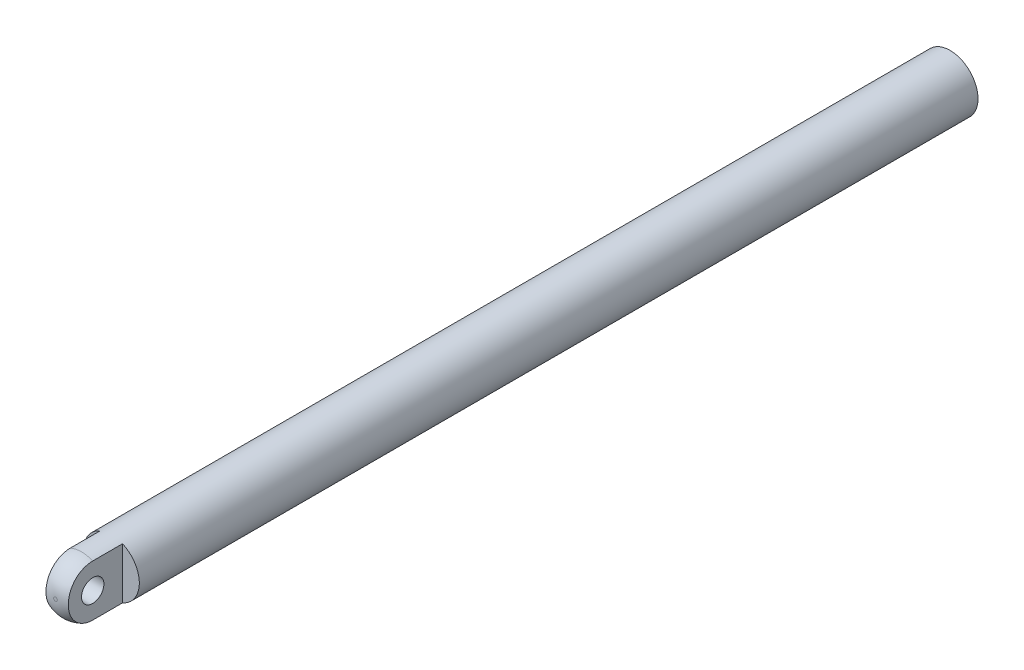
from build123d import *

# Parameters (mm, degrees)
SKETCH_1_R          = 75
EXTRUDE_1_DEPTH     = 2400
CUT_EXTRUDE_1_DEPTH = 150
SKETCH_3_R          = 30
CUT_EXTRUDE_2_DEPTH = 150
FILLET_1_R          = 70
SKETCH_4_R          = 60
CUT_EXTRUDE_4_DEPTH = 2200
SCALE_1_SCALE       = 0.345


with BuildPart() as part:
    # 草图1 → 凸台-拉伸1 (new body)
    with BuildSketch(Plane.XY):
        Circle(SKETCH_1_R)
    extrude(amount=EXTRUDE_1_DEPTH)

    # 草图2 → 切除-拉伸1 (cut)
    with BuildSketch(Plane.XY.offset(2400)):
        Polygon((-30, 75), (-30, -75), (-133.073279379, -42.369308492), (-77.396642949, 65.414797111), align=None)
        Polygon((30, 75), (30, -75), (106.458623503, -47.875789018), (106.458623503, 55.829594222), align=None)
    extrude(amount=-CUT_EXTRUDE_1_DEPTH, mode=Mode.SUBTRACT)

    # 草图3 → 切除-拉伸2 (cut)
    with BuildSketch(Plane(origin=(30, 0, 0), x_dir=(0, 0, -1), z_dir=(1, 0, 0))):
        with Locations((-2330, 0)):
            Circle(SKETCH_3_R)
    extrude(amount=-CUT_EXTRUDE_2_DEPTH, mode=Mode.SUBTRACT)

    # 圆角1
    # the kernel refuses this fillet: 70 mm, written as the material it takes off along each edge
    with BuildSketch(Plane(origin=(0, 0, 2400), x_dir=(0.3861785994276561, -0.922424029036589, 0), z_dir=(-0.922424029036589, -0.3861785994276561, 0))) as fillet_1_piece_1:
        with BuildLine():
            CenterArc((75 - FILLET_1_R, -FILLET_1_R), FILLET_1_R, 0, 90)
            Line((75 - FILLET_1_R, 0), (75, 0))
            Line((75, 0), (75, -FILLET_1_R))
        make_face()
    revolve(axis=Axis((0, 0, 2400), (0, 0, 1)), revolution_arc=314.566142673, mode=Mode.SUBTRACT)
    with BuildSketch(Plane(origin=(0, 0, 2400), x_dir=(-0.386178599427656, 0.922424029036589, 0), z_dir=(0.922424029036589, 0.386178599427656, 0))) as fillet_1_piece_2:
        with BuildLine():
            CenterArc((75 - FILLET_1_R, -FILLET_1_R), FILLET_1_R, 0, 90)
            Line((75 - FILLET_1_R, 0), (75, 0))
            Line((75, 0), (75, -FILLET_1_R))
        make_face()
    revolve(axis=Axis((0, 0, 2400), (0, 0, 1)), revolution_arc=314.566142673, mode=Mode.SUBTRACT)

    # 草图4 → 切除-拉伸4 (cut)
    with BuildSketch(Plane(origin=(0, 0, 0), x_dir=(-1, 0, 0), z_dir=(0, 0, -1))):
        Circle(SKETCH_4_R)
    extrude(amount=-CUT_EXTRUDE_4_DEPTH, mode=Mode.SUBTRACT)


with BuildPart() as part_1:
    # 缩放比例1: scaled about (0, 0, 0)
    add(part.part.scale(SCALE_1_SCALE))


solid = part_1.part
